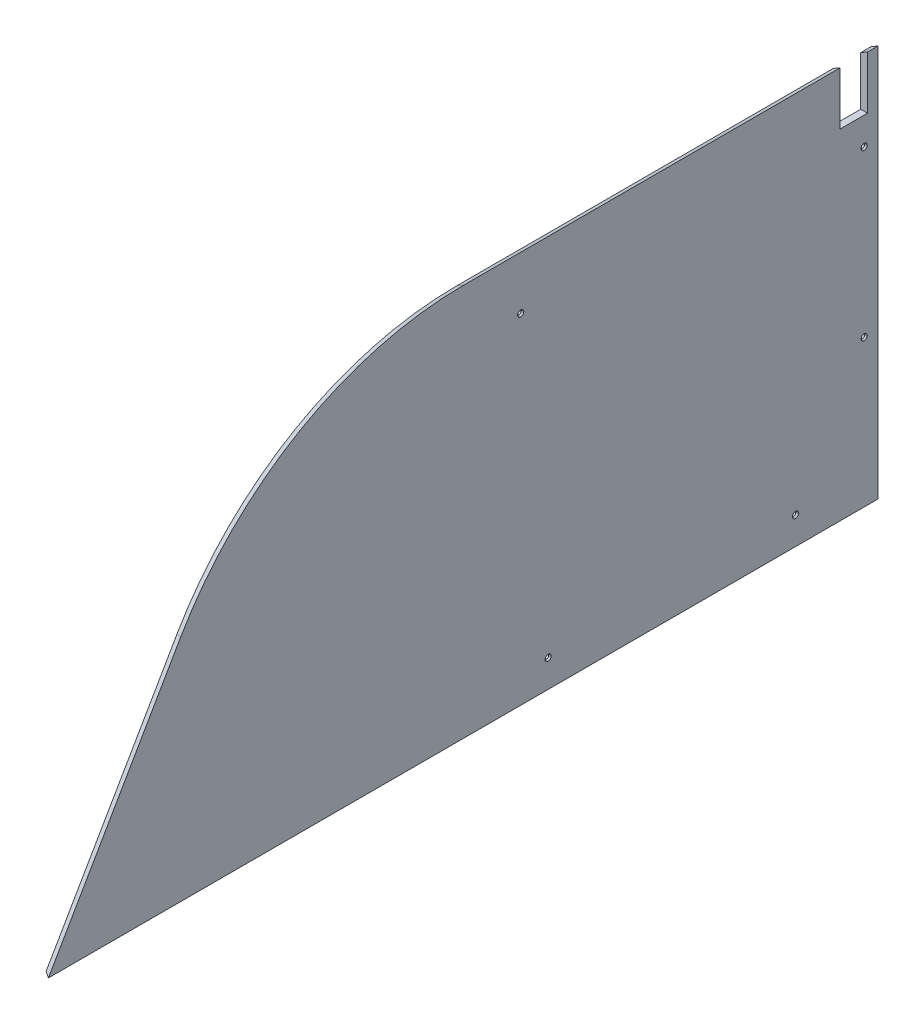
from build123d import *

# Parameters (mm, degrees)
BOSS_EXTRUDE1_DEPTH                            = 6.35
CSK_FOR_4_FLAT_HEAD_MACHINE_SCREW1_D           = 3.2639
CSK_FOR_4_FLAT_HEAD_MACHINE_SCREW1_CSINK_D     = 5.715
CSK_FOR_4_FLAT_HEAD_MACHINE_SCREW1_CSINK_ANGLE = 82
CSK_FOR_4_FLAT_HEAD_MACHINE_SCREW2_D           = 3.2639
CSK_FOR_4_FLAT_HEAD_MACHINE_SCREW2_CSINK_D     = 5.715
CSK_FOR_4_FLAT_HEAD_MACHINE_SCREW2_CSINK_ANGLE = 82
CHAMFER1_SIZE                                  = 10.558581723
CHAMFER1_SIZE_2                                = 6.096
CUT_EXTRUDE1_REACH                             = 697.184
SKETCH8_W                                      = 25.4
SKETCH8_H                                      = 49.00517421
CSK_FOR_4_FLAT_HEAD_MACHINE_SCREW3_D           = 3.2639
CSK_FOR_4_FLAT_HEAD_MACHINE_SCREW3_CSINK_D     = 5.715
CSK_FOR_4_FLAT_HEAD_MACHINE_SCREW3_CSINK_ANGLE = 82


with BuildPart() as part:
    # Sketch1 → Boss-Extrude1 (new body)
    with BuildSketch(Plane(origin=(0, 0, 0), x_dir=(0, 0, -1), z_dir=(1, 0, 0))):
        with BuildLine():
            Line((-123.515928009, -106.162611625), (-0.699091996, 106.562388375))
            ThreePointArc((-0.699091996, 106.562388375), (110.865451078, 218.126931449), (263.265451078, 258.962388375))
            Line((263.265451078, 258.962388375), (646.089089029, 258.962388375))
            Line((646.089089029, 258.962388375), (646.089089029, -106.162611625))
            Line((646.089089029, -106.162611625), (-123.515928009, -106.162611625))
        make_face()
    extrude(amount=BOSS_EXTRUDE1_DEPTH)

    # CSK for #4 Flat Head Machine Screw1 (through all)
    with Locations(Plane(origin=(6.35, 0, 0), x_dir=(0, 0, -1), z_dir=(1, 0, 0))):
        with Locations((633.389089029, 29.727388375)):
            CounterSinkHole(CSK_FOR_4_FLAT_HEAD_MACHINE_SCREW1_D / 2, CSK_FOR_4_FLAT_HEAD_MACHINE_SCREW1_CSINK_D / 2, counter_sink_angle=CSK_FOR_4_FLAT_HEAD_MACHINE_SCREW1_CSINK_ANGLE)

    # CSK for #4 Flat Head Machine Screw2 (through all)
    with Locations(Plane(origin=(6.35, 207.527388375, -315.889089029), x_dir=(0, 0, 1), z_dir=(1, 0, 0))):
        with Locations((0, 0), (-317.5, 25.4)):
            CounterSinkHole(CSK_FOR_4_FLAT_HEAD_MACHINE_SCREW2_D / 2, CSK_FOR_4_FLAT_HEAD_MACHINE_SCREW2_CSINK_D / 2, counter_sink_angle=CSK_FOR_4_FLAT_HEAD_MACHINE_SCREW2_CSINK_ANGLE)

    # Chamfer1
    # the kernel refuses this chamfer: 10.558581723, 6.096 mm, written as the material it takes off along each edge
    with BuildSketch(Plane(origin=(0, -129.818923765, 137.173906191), x_dir=(0.9998132206222078, 0.009663382806350982, 0.016737469993587533), z_dir=(0, 0.8660254037844402, -0.49999999999999756))) as chamfer1_piece_1:
        Polygon((CHAMFER1_SIZE * 0.999813220617, CHAMFER1_SIZE * 0.0193267656126), (-CHAMFER1_SIZE_2 * 0.0193267656127, CHAMFER1_SIZE_2 * 0.999813220622), (0, 0), align=None)
    extrude(amount=272.949628391, mode=Mode.SUBTRACT)
    with BuildSketch(Plane(origin=(0, -45.837611625, -263.265451078), x_dir=(0, 0.5000000000000027, 0.8660254037844372), z_dir=(0, -0.8660254037844372, 0.5000000000000027))) as chamfer1_piece_2:
        Polygon((304.8 - CHAMFER1_SIZE_2, 0), (304.8, -CHAMFER1_SIZE), (304.8, 0), align=None)
    revolve(axis=Axis((0, -45.837611625, -263.265451078), (-1, 0, 0)), revolution_arc=60, mode=Mode.SUBTRACT)
    with BuildSketch(Plane(origin=(0, 258.962388375, -263.265451078), x_dir=(0.9998132206222078, 0.01932676561270281, 0), z_dir=(0, 0, -1))) as chamfer1_piece_3:
        Polygon((CHAMFER1_SIZE * 0.999813220617, CHAMFER1_SIZE * 0.0193267656126), (-CHAMFER1_SIZE_2 * 0.0193267656127, CHAMFER1_SIZE_2 * 0.999813220622), (0, 0), align=None)
    extrude(amount=410.139594316, mode=Mode.SUBTRACT)

    # Sketch8 → Cut-Extrude1 (cut, up to next)
    with BuildSketch(Plane(origin=(6.35, 0, 0), x_dir=(0, 0, -1), z_dir=(1, 0, 0)), mode=Mode.PRIVATE) as cut_extrude1_sk1:
        with Locations((623.864089029, 232.02997548)):
            Rectangle(SKETCH8_W, SKETCH8_H)
    cut_extrude1_tool1 = extrude(cut_extrude1_sk1.sketch, amount=-CUT_EXTRUDE1_REACH, mode=Mode.PRIVATE) & part.part
    add(cut_extrude1_tool1.solids().sort_by_distance((6.35, 232.029975, -623.864089))[0], mode=Mode.SUBTRACT)

    # CSK for #4 Flat Head Machine Screw3 (through all)
    with Locations(Plane(origin=(6.35, -80.762611625, -569.889089029), x_dir=(0, 0, 1), z_dir=(1, 0, 0))):
        with Locations((0, 0), (228.6, 0)):
            CounterSinkHole(CSK_FOR_4_FLAT_HEAD_MACHINE_SCREW3_D / 2, CSK_FOR_4_FLAT_HEAD_MACHINE_SCREW3_CSINK_D / 2, counter_sink_angle=CSK_FOR_4_FLAT_HEAD_MACHINE_SCREW3_CSINK_ANGLE)


solid = part.part
